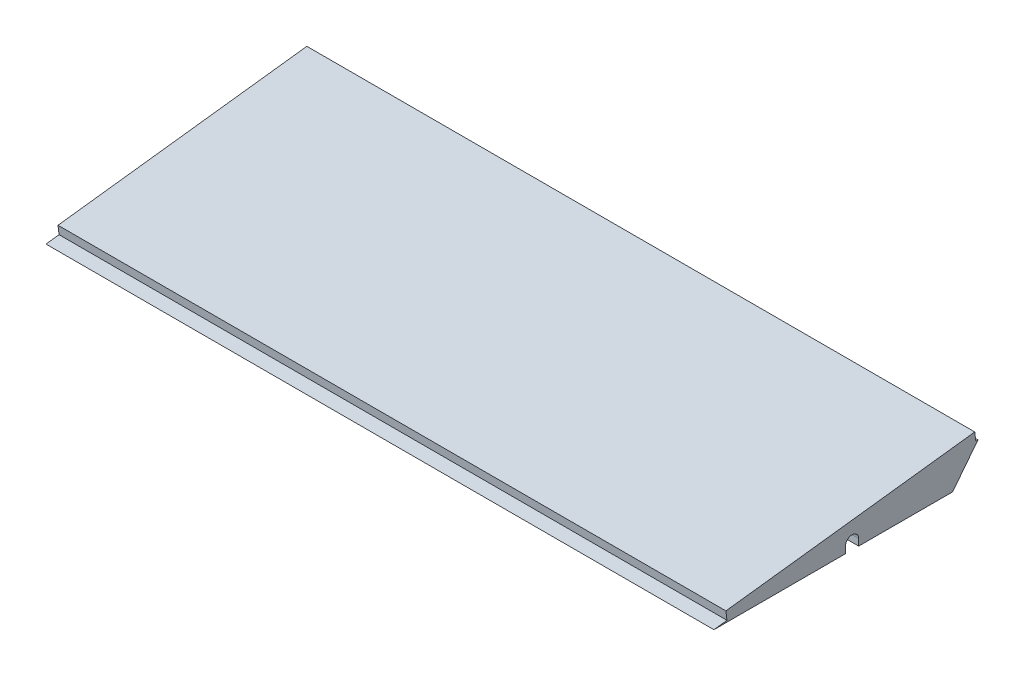
from build123d import *

# Parameters (mm, degrees)
SKETCH2_W           = 121.3
SKETCH2_H           = 304.5
BOSS_EXTRUDE1_DEPTH = 20
CUT_EXTRUDE2_DEPTH  = 329.94119958
SKETCH6_W           = 6
SKETCH6_H           = 6
CUT_EXTRUDE3_DEPTH  = 155.4
SKETCH8_W           = 6
SKETCH8_H           = 6
CUT_EXTRUDE4_DEPTH  = 312.915359451
FILLET2_R           = 3


with BuildPart() as part:
    # Sketch2 → Boss-Extrude1 (new body)
    with BuildSketch(Plane(origin=(0, 0, 0), x_dir=(0, 0.12186934340514809, -0.992546151641322), z_dir=(0, -0.992546151641322, -0.12186934340514809))):
        with Locations((60.65, 152.25)):
            Rectangle(SKETCH2_W, SKETCH2_H)
    extrude(amount=BOSS_EXTRUDE1_DEPTH)

    # Sketch4 → Cut-Extrude2 (cut, through all)
    with BuildSketch(Plane(origin=(304.5, 0, 0), x_dir=(0, 0, -1), z_dir=(1, 0, 0))):
        Polygon((109.333774414, -3.970184607), (0.487477374, -3.970184607), (2.437386868, -19.850923033), (122.833235062, -5.068171678), (120.883325568, 10.812566748), align=None)
        Polygon((5.95527691, 0.73121606), (0, 0), (0.487477374, -3.970184607), (6.442754283, -3.238968546), align=None)
        Polygon((120.883325568, 10.812566748), (120.395848194, 14.782751355), (119.403302042, 14.660882012), (119.890779416, 10.690697405), align=None)
    extrude(amount=-CUT_EXTRUDE2_DEPTH, mode=Mode.SUBTRACT)

    # Sketch6 → Cut-Extrude3 (cut)
    with BuildSketch(Plane(origin=(304.5, 0, 0), x_dir=(0, 0, -1), z_dir=(1, 0, 0))):
        with Locations((63.487477374, -0.970184607)):
            Rectangle(SKETCH6_W, SKETCH6_H)
    extrude(amount=-CUT_EXTRUDE3_DEPTH, mode=Mode.SUBTRACT)

    # Sketch8 → Cut-Extrude4 (cut, through all)
    with BuildSketch(Plane.XY.offset(-66.487477374)):
        with Locations((152.1, -0.970184607)):
            Rectangle(SKETCH8_W, SKETCH8_H)
    extrude(amount=-CUT_EXTRUDE4_DEPTH, mode=Mode.SUBTRACT)

    # Fillet2
    fillet2_edges = [part.edges().sort_by_distance(p)[0] for p in [
        (155.1, 2.029815393, -90.254482773),
        (149.1, 2.029815393, -87.254482773),
        (229.8, 2.029815393, -66.487477374),
        (226.8, 2.029815393, -60.487477374),
        (155.1, -0.970184607, -66.487477374),
        (149.1, -0.970184607, -60.487477374),
    ]]
    fillet(fillet2_edges, radius=FILLET2_R - 0.0001)  # a hair under: the kernel refuses the full size


solid = part.part
